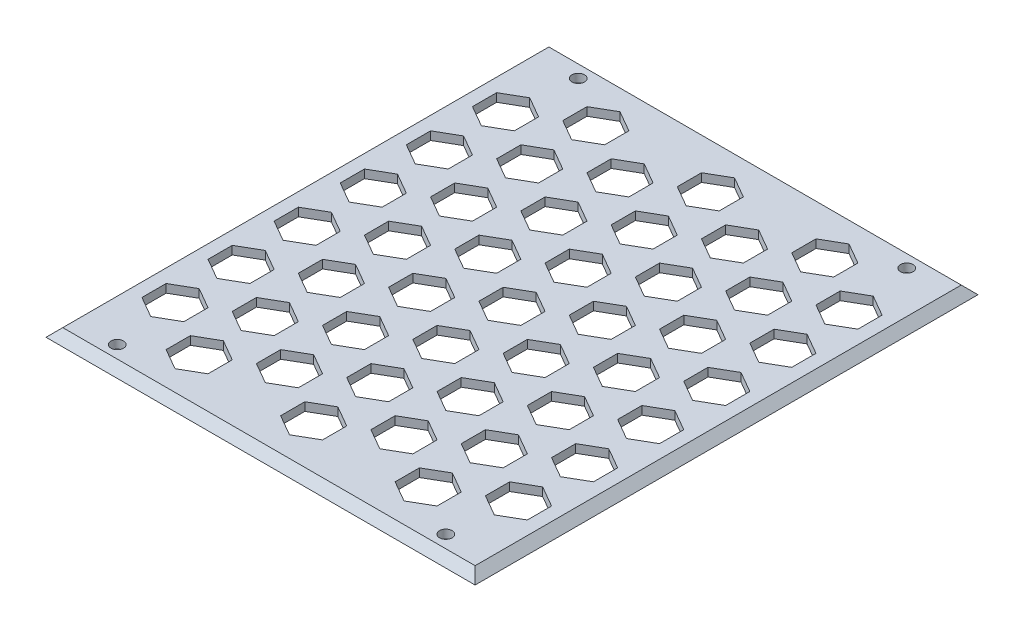
from build123d import *

# Parameters (mm, degrees)
SKETCH1_W           = 130.048
SKETCH1_H           = 152.4
BOSS_EXTRUDE1_DEPTH = 2.54
CHAMFER1_SIZE       = 2.54
SKETCH2_R           = 1.905
CUT_EXTRUDE1_DEPTH  = 101.20485106
CUT_EXTRUDE2_DEPTH  = 101.20485106
FILL_PATTERN2_DEPTH = 2.54


# Read off the part's stored shape, not the designer's step: Fill Pattern2
with BuildPart() as part:
    # Sketch1 → Boss-Extrude1 (new body)
    with BuildSketch(Plane(origin=(0, 0, 0), x_dir=(1, 0, 0), z_dir=(0, 1, 0))):
        Rectangle(SKETCH1_W, SKETCH1_H)
    extrude(amount=BOSS_EXTRUDE1_DEPTH)

    # Chamfer1
    chamfer1_edges = [part.edges().sort_by_distance(p)[0] for p in [
        (65.024, 2.54, 0),
        (0, 2.54, -76.2),
        (-65.024, 2.54, 0),
        (0, 2.54, 76.2),
    ]]
    chamfer(chamfer1_edges, length=CHAMFER1_SIZE - 0.0001)  # a hair under: the kernel refuses the full size

    # Sketch2 → Cut-Extrude1 (cut, through all)
    with BuildSketch(Plane(origin=(0, 2.54, 0), x_dir=(1, 0, 0), z_dir=(0, 1, 0))):
        with Locations(Location((-49.784, 69.85, 0), (0, 0, 270))):
            Circle(SKETCH2_R)
        with Locations(Location((-49.784, -69.85, 0), (0, 0, 90))):
            Circle(SKETCH2_R)
        with Locations(Location((49.784, -69.85, 0), (0, 0, 270))):
            Circle(SKETCH2_R)
        with Locations(Location((49.784, 69.85, 0), (0, 0, 90))):
            Circle(SKETCH2_R)
    extrude(amount=-CUT_EXTRUDE1_DEPTH, mode=Mode.SUBTRACT)

    # Sketch3 → Cut-Extrude2 (cut, through all)
    with BuildSketch(Plane(origin=(0, 2.54, 0), x_dir=(1, 0, 0), z_dir=(0, 1, 0))):
        Polygon((6.35, -3.666174209), (6.35, 3.666174209), (0, 7.332348419), (-6.35, 3.666174209), (-6.35, -3.666174209), (0, -7.332348419), align=None)
    extrude(amount=-CUT_EXTRUDE2_DEPTH, mode=Mode.SUBTRACT)

    # Fill Pattern2 outline → Fill Pattern2 (cut)
    with BuildSketch(Plane(origin=(0, 0, 0), x_dir=(1, 0, 0), z_dir=(0, 1, 0))):
        Polygon((45.70123779, 26.385621941), (52.05123779, 22.719447731), (58.40123779, 26.385621941), (58.40123779, 33.717970359), (52.05123779, 37.384144569), (45.70123779, 33.717970359), align=None)
        Polygon((28.350825194, 16.368356557), (34.700825194, 12.702182348), (41.050825194, 16.368356557), (41.050825194, 23.700704976), (34.700825194, 27.366879185), (28.350825194, 23.700704976), align=None)
        Polygon((11.000412597, 6.351091174), (17.350412597, 2.684916965), (23.700412597, 6.351091174), (23.700412597, 13.683439593), (17.350412597, 17.349613802), (11.000412597, 13.683439593), align=None)
        Polygon((-58.40123779, -33.717970359), (-52.05123779, -37.384144569), (-45.70123779, -33.717970359), (-45.70123779, -26.385621941), (-52.05123779, -22.719447731), (-58.40123779, -26.385621941), align=None)
        Polygon((-41.050825194, -23.700704976), (-34.700825194, -27.366879185), (-28.350825194, -23.700704976), (-28.350825194, -16.368356557), (-34.700825194, -12.702182348), (-41.050825194, -16.368356557), align=None)
        Polygon((-23.700412597, -13.683439593), (-17.350412597, -17.349613802), (-11.000412597, -13.683439593), (-11.000412597, -6.351091174), (-17.350412597, -2.684916965), (-23.700412597, -6.351091174), align=None)
        Polygon((-23.700412597, 13.683439593), (-23.700412597, 6.351091174), (-17.350412597, 2.684916965), (-11.000412597, 6.351091174), (-11.000412597, 13.683439593), (-17.350412597, 17.349613802), align=None)
        Polygon((-58.40123779, 33.717970359), (-58.40123779, 26.385621941), (-52.05123779, 22.719447731), (-45.70123779, 26.385621941), (-45.70123779, 33.717970359), (-52.05123779, 37.384144569), align=None)
        Polygon((-41.050825194, 23.700704976), (-41.050825194, 16.368356557), (-34.700825194, 12.702182348), (-28.350825194, 16.368356557), (-28.350825194, 23.700704976), (-34.700825194, 27.366879185), align=None)
        Polygon((28.350825194, -16.368356557), (28.350825194, -23.700704976), (34.700825194, -27.366879185), (41.050825194, -23.700704976), (41.050825194, -16.368356557), (34.700825194, -12.702182348), align=None)
        Polygon((45.70123779, -26.385621941), (45.70123779, -33.717970359), (52.05123779, -37.384144569), (58.40123779, -33.717970359), (58.40123779, -26.385621941), (52.05123779, -22.719447731), align=None)
        Polygon((11.000412597, -6.351091174), (11.000412597, -13.683439593), (17.350412597, -17.349613802), (23.700412597, -13.683439593), (23.700412597, -6.351091174), (17.350412597, -2.684916965), align=None)
        Polygon((0, 27.366879185), (-6.35, 23.700704976), (-6.35, 16.368356557), (0, 12.702182348), (6.35, 16.368356557), (6.35, 23.700704976), align=None)
        Polygon((0, 67.435940719), (-6.35, 63.769766509), (-6.35, 56.437418091), (0, 52.771243881), (6.35, 56.437418091), (6.35, 63.769766509), align=None)
        Polygon((0, 47.401409952), (-6.35, 43.735235743), (-6.35, 36.402887324), (0, 32.736713115), (6.35, 36.402887324), (6.35, 43.735235743), align=None)
        Polygon((0, -32.736713115), (-6.35, -36.402887324), (-6.35, -43.735235743), (0, -47.401409952), (6.35, -43.735235743), (6.35, -36.402887324), align=None)
        Polygon((0, -52.771243881), (-6.35, -56.437418091), (-6.35, -63.769766509), (0, -67.435940719), (6.35, -63.769766509), (6.35, -56.437418091), align=None)
        Polygon((0, -12.702182348), (-6.35, -16.368356557), (-6.35, -23.700704976), (0, -27.366879185), (6.35, -23.700704976), (6.35, -16.368356557), align=None)
        Polygon((-41.050825194, 56.437418091), (-34.700825194, 52.771243881), (-28.350825194, 56.437418091), (-28.350825194, 63.769766509), (-34.700825194, 67.435940719), (-41.050825194, 63.769766509), align=None)
        Polygon((-58.40123779, 46.420152707), (-52.05123779, 42.753978498), (-45.70123779, 46.420152707), (-45.70123779, 53.752501126), (-52.05123779, 57.418675335), (-58.40123779, 53.752501126), align=None)
        Polygon((11.000412597, 33.717970359), (11.000412597, 26.385621941), (17.350412597, 22.719447731), (23.700412597, 26.385621941), (23.700412597, 33.717970359), (17.350412597, 37.384144569), align=None)
        Polygon((-23.700412597, 53.752501126), (-23.700412597, 46.420152707), (-17.350412597, 42.753978498), (-11.000412597, 46.420152707), (-11.000412597, 53.752501126), (-17.350412597, 57.418675335), align=None)
        Polygon((45.70123779, 13.683439593), (45.70123779, 6.351091174), (52.05123779, 2.684916965), (58.40123779, 6.351091174), (58.40123779, 13.683439593), (52.05123779, 17.349613802), align=None)
        Polygon((-34.700825194, 7.332348419), (-41.050825194, 3.666174209), (-41.050825194, -3.666174209), (-34.700825194, -7.332348419), (-28.350825194, -3.666174209), (-28.350825194, 3.666174209), align=None)
        Polygon((-34.700825194, 47.401409952), (-41.050825194, 43.735235743), (-41.050825194, 36.402887324), (-34.700825194, 32.736713115), (-28.350825194, 36.402887324), (-28.350825194, 43.735235743), align=None)
        Polygon((-34.700825194, -52.771243881), (-41.050825194, -56.437418091), (-41.050825194, -63.769766509), (-34.700825194, -67.435940719), (-28.350825194, -63.769766509), (-28.350825194, -56.437418091), align=None)
        Polygon((-34.700825194, -32.736713115), (-41.050825194, -36.402887324), (-41.050825194, -43.735235743), (-34.700825194, -47.401409952), (-28.350825194, -43.735235743), (-28.350825194, -36.402887324), align=None)
        Polygon((28.350825194, 36.402887324), (34.700825194, 32.736713115), (41.050825194, 36.402887324), (41.050825194, 43.735235743), (34.700825194, 47.401409952), (28.350825194, 43.735235743), align=None)
        Polygon((45.70123779, 46.420152707), (52.05123779, 42.753978498), (58.40123779, 46.420152707), (58.40123779, 53.752501126), (52.05123779, 57.418675335), (45.70123779, 53.752501126), align=None)
        Polygon((-58.40123779, -13.683439593), (-52.05123779, -17.349613802), (-45.70123779, -13.683439593), (-45.70123779, -6.351091174), (-52.05123779, -2.684916965), (-58.40123779, -6.351091174), align=None)
        Polygon((-23.700412597, 33.717970359), (-23.700412597, 26.385621941), (-17.350412597, 22.719447731), (-11.000412597, 26.385621941), (-11.000412597, 33.717970359), (-17.350412597, 37.384144569), align=None)
        Polygon((28.350825194, 3.666174209), (28.350825194, -3.666174209), (34.700825194, -7.332348419), (41.050825194, -3.666174209), (41.050825194, 3.666174209), (34.700825194, 7.332348419), align=None)
        Polygon((45.70123779, -6.351091174), (45.70123779, -13.683439593), (52.05123779, -17.349613802), (58.40123779, -13.683439593), (58.40123779, -6.351091174), (52.05123779, -2.684916965), align=None)
        Polygon((17.350412597, 57.418675335), (11.000412597, 53.752501126), (11.000412597, 46.420152707), (17.350412597, 42.753978498), (23.700412597, 46.420152707), (23.700412597, 53.752501126), align=None)
        Polygon((17.350412597, -22.719447731), (11.000412597, -26.385621941), (11.000412597, -33.717970359), (17.350412597, -37.384144569), (23.700412597, -33.717970359), (23.700412597, -26.385621941), align=None)
        Polygon((17.350412597, -42.753978498), (11.000412597, -46.420152707), (11.000412597, -53.752501126), (17.350412597, -57.418675335), (23.700412597, -53.752501126), (23.700412597, -46.420152707), align=None)
        Polygon((34.700825194, 67.435940719), (28.350825194, 63.769766509), (28.350825194, 56.437418091), (34.700825194, 52.771243881), (41.050825194, 56.437418091), (41.050825194, 63.769766509), align=None)
        Polygon((34.700825194, -52.771243881), (28.350825194, -56.437418091), (28.350825194, -63.769766509), (34.700825194, -67.435940719), (41.050825194, -63.769766509), (41.050825194, -56.437418091), align=None)
        Polygon((34.700825194, -32.736713115), (28.350825194, -36.402887324), (28.350825194, -43.735235743), (34.700825194, -47.401409952), (41.050825194, -43.735235743), (41.050825194, -36.402887324), align=None)
        Polygon((52.05123779, -42.753978498), (45.70123779, -46.420152707), (45.70123779, -53.752501126), (52.05123779, -57.418675335), (58.40123779, -53.752501126), (58.40123779, -46.420152707), align=None)
        Polygon((-58.40123779, 6.351091174), (-52.05123779, 2.684916965), (-45.70123779, 6.351091174), (-45.70123779, 13.683439593), (-52.05123779, 17.349613802), (-58.40123779, 13.683439593), align=None)
        Polygon((-52.05123779, -42.753978498), (-58.40123779, -46.420152707), (-58.40123779, -53.752501126), (-52.05123779, -57.418675335), (-45.70123779, -53.752501126), (-45.70123779, -46.420152707), align=None)
        Polygon((-17.350412597, -42.753978498), (-23.700412597, -46.420152707), (-23.700412597, -53.752501126), (-17.350412597, -57.418675335), (-11.000412597, -53.752501126), (-11.000412597, -46.420152707), align=None)
        Polygon((-17.350412597, -22.719447731), (-23.700412597, -26.385621941), (-23.700412597, -33.717970359), (-17.350412597, -37.384144569), (-11.000412597, -33.717970359), (-11.000412597, -26.385621941), align=None)
    extrude(amount=FILL_PATTERN2_DEPTH, mode=Mode.SUBTRACT)


solid = part.part
